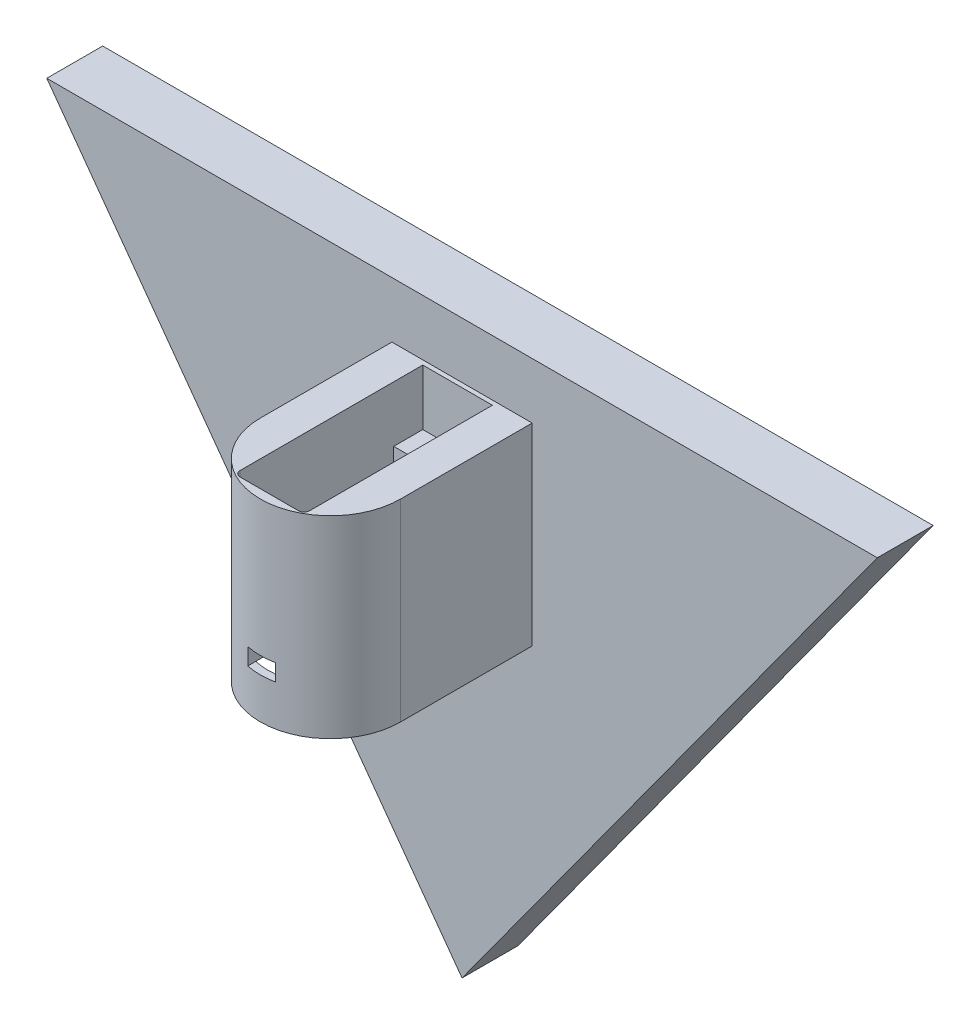
from build123d import *
from OCP.BRepFilletAPI import BRepFilletAPI_MakeChamfer

# Parameters (mm, degrees)
SKETCH4_W                = 12.46
SKETCH4_H                = 17.25
BOSS_EXTRUDE3_DEPTH      = 6
BOSS_EXTRUDE6_DEPTH      = 7.3
BOSS_EXTRUDE6_DEPTH_BACK = 17.25
SKETCH8_R                = 12.546781182
SKETCH8_R_2              = 11.15
BOSS_EXTRUDE4_DEPTH      = 17.25
SKETCH6_R                = 2
CUT_EXTRUDE1_DEPTH       = 5
CHAMFER1_SIZE            = 0.5
CHAMFER1_SIZE_2          = 0.866025404
SKETCH10_W               = 12.46
SKETCH10_H               = 23.7
CUT_EXTRUDE3_DEPTH       = 17.25
CUT_EXTRUDE4_REACH       = 43.938
SKETCH11_W               = 5
SKETCH11_H               = 3
BOSS_EXTRUDE7_START      = -7.3
BOSS_EXTRUDE7_DEPTH      = 7.3
BOSS_EXTRUDE9_START      = 10
BOSS_EXTRUDE9_DEPTH      = 10
OFFSET_R_DEPTH           = 10


with BuildPart() as part:
    # Sketch4 → Boss-Extrude3 (new body)
    with BuildSketch(Plane.XY):
        with Locations((0, -1.35)):
            Rectangle(SKETCH4_W, SKETCH4_H)
    extrude(amount=BOSS_EXTRUDE3_DEPTH)



with BuildPart() as body_2:
    # Sketch8 → Boss-Extrude6 (new, two sides: drawn at the far end of the back side and taken through both)
    with BuildSketch(Plane(origin=(0, -9.975, 0), x_dir=(-1, 0, 0), z_dir=(0, -1, 0)).offset(-BOSS_EXTRUDE6_DEPTH_BACK)):
        with Locations(Location((0, -23.55, 0), (0, 0, 90))):
            Circle(SKETCH8_R)
        with Locations(Location((0, -23.55, 0), (0, 0, 90))):
            Circle(SKETCH8_R_2, mode=Mode.SUBTRACT)
    extrude(amount=BOSS_EXTRUDE6_DEPTH + BOSS_EXTRUDE6_DEPTH_BACK)


with BuildPart() as part_1:
    add(part.part)

    add(body_2.part)  # Boss-Extrude4 merges body 2
    # Sketch5 → Boss-Extrude4 (add)
    with BuildSketch(Plane(origin=(0, 7.275, 0), x_dir=(1, 0, 0), z_dir=(0, 1, 0))):
        with BuildLine():
            Line((12.546781182, -23.55), (12.546781182, 0))
            Line((12.546781182, 0), (6.23, 0))
            Line((6.23, 0), (6.23, -29.7))
            Line((6.23, -29.7), (-6.23, -29.7))
            Line((-6.23, -29.7), (-6.23, 0))
            Line((-6.23, 0), (-12.546781182, 0))
            Line((-12.546781182, 0), (-12.546781182, -23.55))
            ThreePointArc((-12.546781182, -23.55), (0, -36.096781182), (12.546781182, -23.55))
        make_face()
    extrude(amount=-BOSS_EXTRUDE4_DEPTH)

    # Sketch6 → Cut-Extrude1 (cut)
    with BuildSketch(Plane(origin=(0, 7.275, 0), x_dir=(1, 0, 0), z_dir=(0, 1, 0))):
        with Locations(Location((0, -3.5, 0), (0, 0, 270))):
            Circle(SKETCH6_R)
        with Locations(Location((0, -32.2, 0), (0, 0, 270))):
            Circle(SKETCH6_R)
    extrude(amount=-CUT_EXTRUDE1_DEPTH, mode=Mode.SUBTRACT)

    # Chamfer1
    chamfer1_edges_1 = [part_1.edges().sort_by_distance(p)[0] for p in [
        (0, 7.275, 1.5),
    ]]
    chamfer1_side_1 = [part_1.faces().sort_by_distance(p)[0] for p in [
        (0, 7.275, 1.49),
    ]]
    chamfer1_edges_2 = [part_1.edges().sort_by_distance(p)[0] for p in [
        (0, 7.275, 30.2),
    ]]
    chamfer1_side_2 = [part_1.faces().sort_by_distance(p)[0] for p in [
        (0, 7.275, 30.19),
    ]]
    chamfer1 = BRepFilletAPI_MakeChamfer(part_1.part.solid().wrapped)
    for e in chamfer1_edges_1:
        chamfer1.Add(CHAMFER1_SIZE - 0.0001, CHAMFER1_SIZE_2 - 0.0001, e.wrapped, chamfer1_side_1[0].wrapped)
    for e in chamfer1_edges_2:
        chamfer1.Add(CHAMFER1_SIZE - 0.0001, CHAMFER1_SIZE_2 - 0.0001, e.wrapped, chamfer1_side_2[0].wrapped)
    add(Compound.cast(chamfer1.Shape()), mode=Mode.REPLACE)  # a hair under: the kernel refuses the full size

    # Sketch10 → Cut-Extrude3 (cut)
    with BuildSketch(Plane(origin=(0, 7.275, 0), x_dir=(1, 0, 0), z_dir=(0, 1, 0))):
        with Locations((0, -17.85)):
            Rectangle(SKETCH10_W, SKETCH10_H)
    extrude(amount=-CUT_EXTRUDE3_DEPTH, mode=Mode.SUBTRACT)

    # Sketch11 → Cut-Extrude4 (cut, up to next)
    with BuildSketch(Plane.XY.offset(36.096781182), mode=Mode.PRIVATE) as cut_extrude4_sk1:
        with Locations((0, -8.475)):
            Rectangle(SKETCH11_W, SKETCH11_H)
    cut_extrude4_tool1 = extrude(cut_extrude4_sk1.sketch, amount=-CUT_EXTRUDE4_REACH, mode=Mode.PRIVATE) & part_1.part
    add(cut_extrude4_tool1.solids().sort_by_distance((0, -8.475, 36.096781))[0], mode=Mode.SUBTRACT)

    # Sketch13 → Boss-Extrude7 (add)
    with BuildSketch(Plane.XZ.offset(17.275).offset(BOSS_EXTRUDE7_START)):
        with BuildLine():
            Line((-12.546781182, 23.55), (-12.546781182, 0))
            Line((-12.546781182, 0), (12.546781182, 0))
            Line((12.546781182, 0), (12.546781182, 23.55))
            ThreePointArc((12.546781182, 23.55), (0, 11.003218818), (-12.546781182, 23.55))
        make_face()
    extrude(amount=BOSS_EXTRUDE7_DEPTH)

    # Sketch15 → Boss-Extrude9 (add)
    with BuildSketch(Plane(origin=(0, 7.275, 0), x_dir=(1, 0, 0), z_dir=(0, 1, 0)).offset(BOSS_EXTRUDE9_START)):
        with BuildLine():
            Line((-12.546781182, 0), (12.546781182, 0))
            Line((12.546781182, 0), (12.546781182, -23.55))
            ThreePointArc((12.546781182, -23.55), (0, -36.096781182), (-12.546781182, -23.55))
            Line((-12.546781182, -23.55), (-12.546781182, 0))
        make_face()
        with BuildLine():
            Line((-6.23, -0.8), (6.23, -0.8))
            Line((6.23, -0.8), (6.23, -33.5))
            ThreePointArc((6.23, -33.5), (5.937106781, -34.207106781), (5.23, -34.5))
            Line((5.23, -34.5), (-5.23, -34.5))
            ThreePointArc((-5.23, -34.5), (-5.937106781, -34.207106781), (-6.23, -33.5))
            Line((-6.23, -33.5), (-6.23, -0.8))
        make_face(mode=Mode.SUBTRACT)
    extrude(amount=-BOSS_EXTRUDE9_DEPTH)

    # Sketch1 → Offset R (add)
    with BuildSketch(Plane.XY):
        Polygon((0, -75), (74.307137052, 27.275), (-74.307137052, 27.275), align=None)
    extrude(amount=-OFFSET_R_DEPTH)


solid = part_1.part
